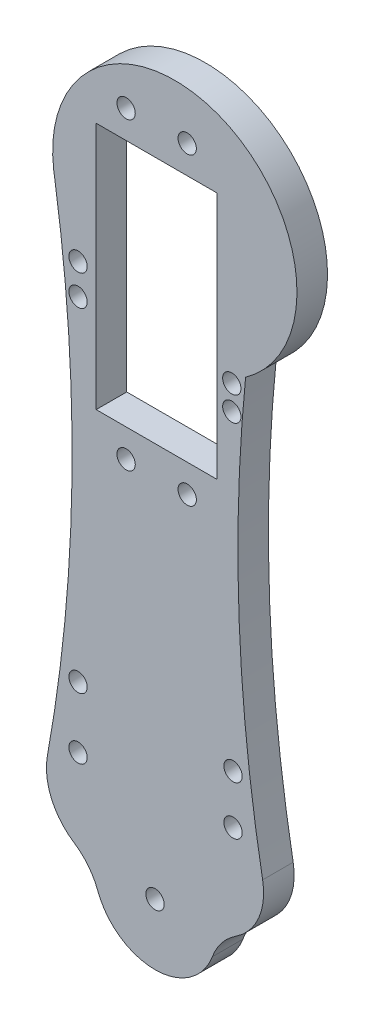
from build123d import *

# Parameters (mm, degrees)
RESSALTO_EXTRUS_O1_DEPTH = 5
FILETE3_R                = 10
FILETE4_R                = 10
ESBO_O2_R                = 1.5
CORTE_EXTRUS_O1_DEPTH    = 5
ESBO_O4_R                = 1.5
CORTE_EXTRUS_O3_DEPTH    = 10
ESBO_O5_W                = 19.8
ESBO_O5_H                = 40.6
CORTE_EXTRUS_O4_DEPTH    = 10
ESBO_O6_R                = 1.5
CORTE_EXTRUS_O5_DEPTH    = 10
ESBO_O7_R                = 1.5
CORTE_EXTRUS_O6_DEPTH    = 121.092170275


with BuildPart() as part:
    # Esboço1 → Ressalto-extrusão1 (new body)
    with BuildSketch(Plane.XY):
        with BuildLine():
            ThreePointArc((-10, 0), (0, -10), (10, 0))
            Line((10, 0), (20, 0))
            ThreePointArc((20, 0), (14.071698091, 40.495175194), (14.829943665, 81.414963086))
            ThreePointArc((14.829943665, 81.414963086), (11.193742071, 116.066691762), (-16.576524471, 95.024435265))
            Line((-16.576524471, 95.024435265), (-16.487894969, 94.437265709))
            Line((-16.487894969, 94.437265709), (-16.369382775, 93.652123615))
            ThreePointArc((-16.369382775, 93.652123615), (-13.756795166, 46.654405302), (-20, 0))
            Line((-20, 0), (-10, 0))
        make_face()
    extrude(amount=RESSALTO_EXTRUS_O1_DEPTH)

    # Filete3
    # the kernel refuses this fillet: 10 mm, written as the material it takes off along each edge
    with BuildSketch(Plane(origin=(20, 0, -29.463728433), x_dir=(-0.20232831186330175, 0.9793177493635794, 0), z_dir=(0, 0, 1))) as filete3_piece_1:
        with BuildLine():
            CenterArc((12.021201201, 9.997221658), FILETE3_R, 181.169168083, 87.480189)
            Line((2.023283119, 9.793177494), (1.823324757, 9.78909661))
            ThreePointArc((1.823324757, 9.78909661), (0.815778009, 4.937054409), (-0.19586355, 0.040465662))
            Line((-0.19586355, 0.040465662), (0.004714197, -0.199944433))
            ThreePointArc((0.004714197, -0.199944433), (5.892745687, -0.130541448), (11.780777177, -0.199944433))
            Line((11.780777177, -0.199944433), (11.785491373, 0))
        make_face()
    extrude(amount=63.927456867, mode=Mode.SUBTRACT)
    with BuildSketch(Plane(origin=(-20, 0, -29.463728433), x_dir=(1, 0, 0), z_dir=(0, 0, 1))) as filete3_piece_2:
        with BuildLine():
            CenterArc((12.222685959, 9.749854723), FILETE3_R, 169.67749742, 87.480189)
            Line((2.384538574, 11.541740887), (2.187775626, 11.57757861))
            ThreePointArc((2.187775626, 11.57757861), (1.06442773, 5.797282674), (-0.194855317, 0.045071116))
            Line((-0.194855317, 0.045071116), (0, -0.2))
            ThreePointArc((0, -0.2), (5, -0.2), (9.955546281, -0.194997094))
            Line((9.955546281, -0.194997094), (10, 0))
        make_face()
    extrude(amount=63.927456867, mode=Mode.SUBTRACT)

    # Filete4
    filete4_edges = [part.edges().sort_by_distance(p)[0] for p in [
        (10, 0, 2.5),
        (-10, 0, 2.5),
    ]]
    fillet(filete4_edges, radius=FILETE4_R)

    # Esboço2 → Corte-extrusão1 (cut)
    with BuildSketch(Plane.XY.offset(5)):
        Circle(ESBO_O2_R)
    extrude(amount=-CORTE_EXTRUS_O1_DEPTH, mode=Mode.SUBTRACT)

    # Esboço4 → Corte-extrusão3 (cut)
    with BuildSketch(Plane.XY.offset(5)):
        with Locations((-4.732435028, 109.78)):
            Circle(ESBO_O4_R)
        with Locations((5.267564972, 109.78)):
            Circle(ESBO_O4_R)
        with Locations((-4.732435028, 60)):
            Circle(ESBO_O4_R)
        with Locations((5.267564972, 60)):
            Circle(ESBO_O4_R)
    extrude(amount=-CORTE_EXTRUS_O3_DEPTH, mode=Mode.SUBTRACT)

    # Esboço5 → Corte-extrusão4 (cut)
    with BuildSketch(Plane.XY.offset(5)):
        with Locations((0.267564972, 84.89)):
            Rectangle(ESBO_O5_W, ESBO_O5_H)
    extrude(amount=-CORTE_EXTRUS_O4_DEPTH, mode=Mode.SUBTRACT)

    # Esboço6 → Corte-extrusão5 (cut)
    with BuildSketch(Plane(origin=(0, 0, 0), x_dir=(-1, 0, 0), z_dir=(0, 0, -1))):
        with Locations((12.6, 14.5)):
            Circle(ESBO_O6_R)
        with Locations((12.6, 24.5)):
            Circle(ESBO_O6_R)
        with Locations((12.6, 79.11)):
            Circle(ESBO_O6_R)
        with Locations((12.6, 84.11)):
            Circle(ESBO_O6_R)
    extrude(amount=-CORTE_EXTRUS_O5_DEPTH, mode=Mode.SUBTRACT)

    # Esboço7 → Corte-extrusão6 (cut, through all)
    with BuildSketch(Plane(origin=(0, 0, 0), x_dir=(-1, 0, 0), z_dir=(0, 0, -1))):
        with Locations((-12.77, 16.54)):
            Circle(ESBO_O7_R)
        with Locations((-12.77, 24.54)):
            Circle(ESBO_O7_R)
        with Locations((-12.57, 75.41)):
            Circle(ESBO_O7_R)
        with Locations((-12.57, 79.41)):
            Circle(ESBO_O7_R)
    extrude(amount=-CORTE_EXTRUS_O6_DEPTH, mode=Mode.SUBTRACT)


solid = part.part
